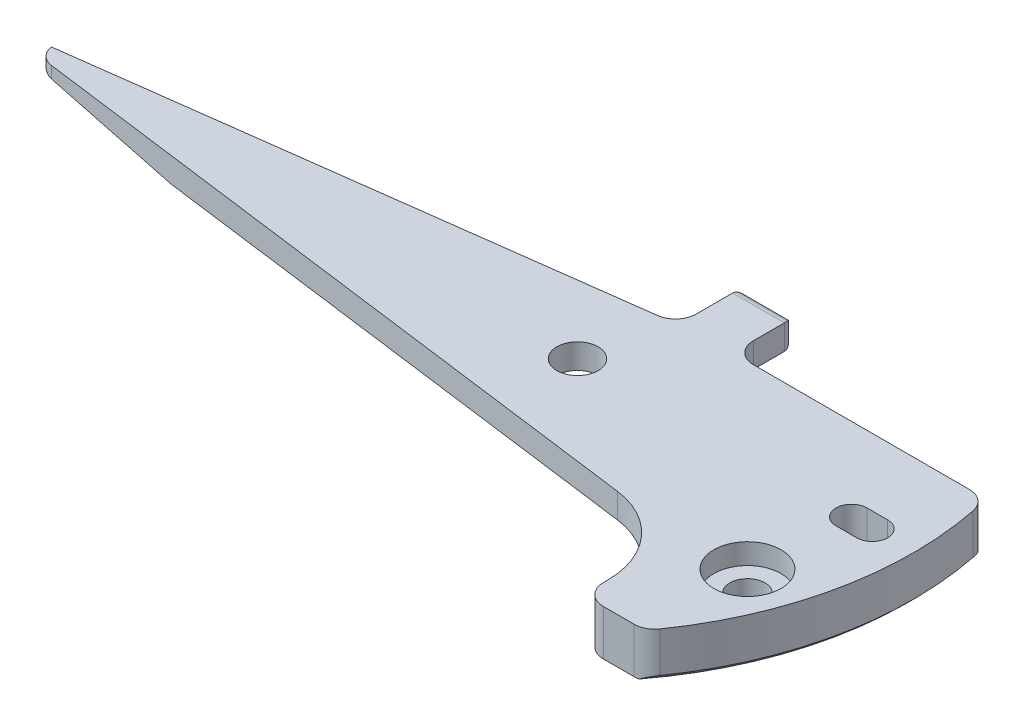
from build123d import *

# Parameters (mm, degrees)
BOSS_EXTRUDE1_DEPTH            = 2.4
BOSS_EXTRUDE2_DEPTH            = 2.4
BOSS_EXTRUDE2_DEPTH_BACK       = 2
FILLET1_R                      = 8
FILLET2_R                      = 2
F_3_0MM_START                  = -2
F_3_0MM_DOWEL_SLOT1_DEPTH      = 4.4
F_4_0_4_DIAMETER_HOLE1_D       = 4
CBORE_FOR_M3_SHCS1_D           = 3.4
CBORE_FOR_M3_SHCS1_CBORE_D     = 6.5
CBORE_FOR_M3_SHCS1_CBORE_DEPTH = 2
FILLET5_R                      = 2
FILLET6_R                      = 1
FILLET8_R                      = 2
CUT_EXTRUDE1_DEPTH             = 38
CHAMFER2_SIZE2                 = 1.9
CHAMFER2_SIZE                  = 5.220207097
FILLET9_R                      = 3


# Read off the part's stored shape, not the designer's step: Ø3.0mm Dowel Slot1
# Some blends are built 0.0001 mm under size
with BuildPart() as part:
    # Sketch1 → Boss-Extrude1 (new body)
    with BuildSketch(Plane(origin=(0, 0, 0), x_dir=(1, 0, 0), z_dir=(0, 1, 0))):
        with BuildLine():
            Line((2, 7.720929875), (-51.546411114, 0.671411114))
            ThreePointArc((-51.546411114, 0.671411114), (-51.035673477, -0.364262362), (-50, -0.875))
            Line((-50, -0.875), (20, -10.090674831))
            Line((20, -10.090674831), (20, 8))
            Line((20, 8), (7, 8))
            Line((7, 8), (7, 14))
            Line((7, 14), (2, 14))
            Line((2, 14), (2, 7.720929875))
        make_face()
    extrude(amount=BOSS_EXTRUDE1_DEPTH)

    # Sketch1<6> → Boss-Extrude2 (add, two sides: drawn at the far end of the back side and taken through both)
    with BuildSketch(Plane(origin=(0, 0, 0), x_dir=(1, 0, 0), z_dir=(0, 1, 0)).offset(-BOSS_EXTRUDE2_DEPTH_BACK)):
        with BuildLine():
            Line((20, 8), (20, -10.090674831))
            Line((20, -10.090674831), (20, -19.5))
            Line((20, -19.5), (26, -19.5))
            ThreePointArc((26, -19.5), (31.86887196, -6.373774392), (31.5, 8))
            Line((31.5, 8), (20, 8))
        make_face()
    extrude(amount=BOSS_EXTRUDE2_DEPTH + BOSS_EXTRUDE2_DEPTH_BACK)

    # Fillet1
    fillet1_edges = [part.edges().sort_by_distance(p)[0] for p in [
        (20, 1.2, 10.090674831),
    ]]
    fillet(fillet1_edges, radius=FILLET1_R)

    # Fillet2
    fillet2_edges = [part.edges().sort_by_distance(p)[0] for p in [
        (20, 0.2, 19.5),
        (31.5, 0.2, -8),
        (26, 0.2, 19.5),
    ]]
    fillet(fillet2_edges, radius=FILLET2_R)

    # Ø3.0mm Dowel Slot1 outline → Ø3.0mm Dowel Slot1 (cut)
    with BuildSketch(Plane(origin=(0, 0, 0), x_dir=(1, 0, 0), z_dir=(0, 1, 0)).offset(F_3_0MM_START)):
        with BuildLine():
            Line((26.5, -1.5), (28.5, -1.5))
            ThreePointArc((28.5, -1.5), (30, 0), (28.5, 1.5))
            Line((28.5, 1.5), (26.5, 1.5))
            ThreePointArc((26.5, 1.5), (25, 0), (26.5, -1.5))
        make_face()
    extrude(amount=F_3_0MM_DOWEL_SLOT1_DEPTH, mode=Mode.SUBTRACT)

    # Ø4.0 (4) Diameter Hole1 (through all)
    with Locations(Plane(origin=(0, 2.4, 0), x_dir=(1, 0, 0), z_dir=(0, 1, 0))):
        with Locations((0, 0)):
            Hole(F_4_0_4_DIAMETER_HOLE1_D / 2)

    # CBORE for M3 SHCS1 (through all)
    with Locations(Plane(origin=(0, 2.4, 0), x_dir=(1, 0, 0), z_dir=(0, 1, 0))):
        with Locations((25.841547072, -9.405553941)):
            CounterBoreHole(CBORE_FOR_M3_SHCS1_D / 2, CBORE_FOR_M3_SHCS1_CBORE_D / 2, CBORE_FOR_M3_SHCS1_CBORE_DEPTH)

    # Fillet5
    fillet5_edges = [part.edges().sort_by_distance(p)[0] for p in [
        (2, 1.2, -7.720929875),
        (7, 1.2, -8),
    ]]
    fillet(fillet5_edges, radius=FILLET5_R)

    # Fillet6
    fillet6_edges = [part.edges().sort_by_distance(p)[0] for p in [
        (4.5, 0, -14),
        (2, 1.2, -14),
        (7, 1.2, -14),
        (4.5, 2.4, -14),
    ]]
    fillet(fillet6_edges, radius=FILLET6_R)

    # Chamfer1
    # the kernel refuses this chamfer: 0.5 mm, written as the material it takes off along each edge
    with BuildSketch(Plane(origin=(0, -2, 0), x_dir=(0.7609198459057782, 0, 0.6488458893348455), z_dir=(-0.6488458893348455, 0, 0.7609198459057782))) as chamfer1_piece_1:
        with BuildLine():
            Line((32.514142136, 0.514142136), (31.985857864, -0.014142136))
            Line((31.985857864, -0.014142136), (31.985857864, -0.024142136))
            ThreePointArc((31.985857864, -0.024142136), (32.242928932, -0.01), (32.5, -0.01))
            Line((32.5, -0.01), (32.51, 0))
            ThreePointArc((32.51, 0), (32.51, 0.257071068), (32.524142136, 0.514142136))
            Line((32.524142136, 0.514142136), (32.514142136, 0.514142136))
        make_face()
    revolve(axis=Axis((0, -2, 0), (0, 1, 0)), revolution_arc=57.24100759, mode=Mode.SUBTRACT)

    # Fillet8
    fillet8_edges = [part.edges().sort_by_distance(p)[0] for p in [
        (20, 0, 4.553243268),
    ]]
    fillet(fillet8_edges, radius=FILLET8_R - 0.0001)  # a hair under: the kernel refuses the full size

    # Sketch8 → Cut-Extrude1 (cut)
    with BuildSketch(Plane(origin=(-50.581323439, 0, 6.659157562), x_dir=(0, -1, 0), z_dir=(0.9914448613738104, 0, -0.13052619222005302))):
        Polygon((-1.9, 7.393823865), (0, 2.173616768), (0, 7.393823865), align=None)
    extrude(amount=CUT_EXTRUDE1_DEPTH, mode=Mode.SUBTRACT)

    # Chamfer2
    chamfer2_edges = [part.edges().sort_by_distance(p)[0] for p in [
        (-13.530819505, 0, -3.043632668),
    ]]
    chamfer2_side = [part.faces().sort_by_distance(p)[0] for p in [
        (-13.4931446, 0, -3.048592663),
    ]]
    chamfer(chamfer2_edges, length=CHAMFER2_SIZE - 0.0001, length2=CHAMFER2_SIZE2 - 0.0001, reference=chamfer2_side[0])  # a hair under: the kernel refuses the full size

    # Fillet9
    fillet9_edges = [part.edges().sort_by_distance(p)[0] for p in [
        (-10.943077395, 0.94995, -3.384176821),
    ]]
    fillet(fillet9_edges, radius=FILLET9_R)


solid = part.part
